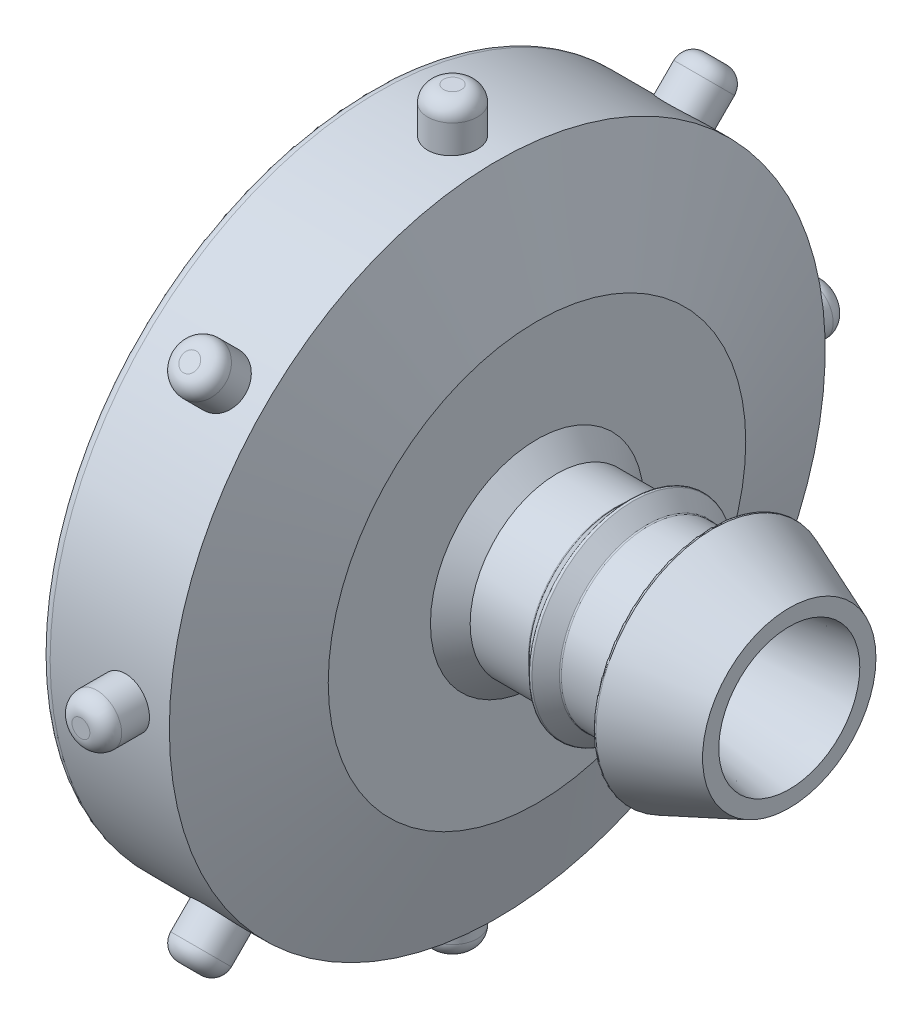
from build123d import *

# Parameters (mm, degrees)
SKETCH2_R                 = 16.51
BOSS_EXTRUDE1_DEPTH       = 1.5
CUT_EXTRUDE1_DEPTH        = 27.579130911
CUT_EXTRUDE1_DEPTH_BACK   = 27.579130911
SKETCH2_5_R               = 2.55
SKETCH2_5_W               = 2.46
SKETCH2_5_H               = 4.35
SKETCH2_6_R               = 16.51
SKETCH2_6_W               = 18.8
SKETCH2_6_H               = 13.4
BOSS_EXTRUDE4_DEPTH       = 8.5
CUT_SWEEP1_PROFILE_R      = 0.9
CHAMFER1_SIZE             = 6
CHAMFER1_SIZE2            = 2
SKETCH18_W                = 3.5
SKETCH18_H                = 7.65
BOSS_EXTRUDE7_DEPTH       = 0.64
FILLET7_R                 = 0.5
CHAMFER5_SIZE             = 1
CHAMFER5_SIZE2            = 4
FILLET9_R                 = 0.5
FILLET10_R                = 0.1
BOSS_EXTRUDE8_START       = -2
BOSS_EXTRUDE8_DEPTH       = 4.2
FILLET11_R                = 0.8
CIRPATTERN4_COUNT         = 8
FILLET11_OF_CIRPATTERN4_R = 0.8
CHAMFER7_SIZE             = 1
CHAMFER8_SIZE             = 7
CHAMFER8_SIZE2            = 1


with BuildPart() as part:
    # Sketch1 → Revolve1 (revolve)
    with BuildSketch(Plane(origin=(0, 0, 0), x_dir=(1, 0, 0), z_dir=(0, 1, 0))):
        Polygon((0, 0), (-12.7, 0), (-12.7, 4.365), (-8.73, 4.365), (-7.94, 5.155), (-7.15, 4.365), (-3.97, 4.365), (-3.97, 5.955), (0, 4.365), align=None)
    revolve(axis=Axis((0, 0, 0), (-1, 0, 0)))

    # Sketch2 → Boss-Extrude1 (add)
    with BuildSketch(Plane.ZY.offset(12.7)):
        Circle(SKETCH2_R)
    extrude(amount=BOSS_EXTRUDE1_DEPTH)

    # Sketch2<5> → Cut-Extrude1 (cut, two sides: drawn at the far end of the back side and taken through both)
    # profile 1 of 2: a face of its own
    with BuildSketch(Plane.ZY.offset(12.7).offset(-CUT_EXTRUDE1_DEPTH_BACK)):
        Circle(SKETCH2_5_R)
        Rectangle(SKETCH2_5_W, SKETCH2_5_H, mode=Mode.SUBTRACT)
    # profile 2 of 2: a face of its own
    with BuildSketch(Plane.ZY.offset(12.7).offset(-CUT_EXTRUDE1_DEPTH_BACK)):
        Rectangle(SKETCH2_5_W, SKETCH2_5_H)
    extrude(amount=CUT_EXTRUDE1_DEPTH + CUT_EXTRUDE1_DEPTH_BACK, mode=Mode.SUBTRACT)

    # Sketch2<6> → Boss-Extrude4 (add)
    with BuildSketch(Plane.ZY.offset(12.7)):
        Circle(SKETCH2_6_R)
        with Locations((0, 0.4)):
            Rectangle(SKETCH2_6_W, SKETCH2_6_H, mode=Mode.SUBTRACT)
    extrude(amount=BOSS_EXTRUDE4_DEPTH)

    # Cut-Sweep1: sweep along a path in Sketch8
    with BuildLine(Plane.ZY.offset(21.2)) as cut_sweep1_path:
        CenterArc((0, 0), 14.14145, 0, 360)
    # Cut-Sweep1 profile (on start of the path) → Cut-Sweep1 (sweep, cut)
    with BuildSketch(Plane(origin=(-21.2, 0, 14.14145), x_dir=(0, 0, 1), z_dir=(0, 1, 0))):
        Circle(CUT_SWEEP1_PROFILE_R)
    sweep(path=cut_sweep1_path.line, mode=Mode.SUBTRACT)

    # Chamfer1
    chamfer1_edges = [part.edges().sort_by_distance(p)[0] for p in [
        (-12.7, 0, -16.51),
    ]]
    chamfer1_side = [part.faces().sort_by_distance(p)[0] for p in [
        (-12.7, 0, -16.043026682),
    ]]
    chamfer(chamfer1_edges, length=CHAMFER1_SIZE, length2=CHAMFER1_SIZE2, reference=chamfer1_side[0])

    # Sketch18 → Boss-Extrude7 (add)
    with BuildSketch(Plane.ZY.offset(14.2)):
        with Locations((-7.65, -2.475)):
            Rectangle(SKETCH18_W, SKETCH18_H)
    extrude(amount=BOSS_EXTRUDE7_DEPTH)

    # Fillet7
    fillet7_edges = [part.edges().sort_by_distance(p)[0] for p in [
        (-14.84, -2.475, -5.9),
        (-14.84, 1.35, -7.65),
    ]]
    fillet(fillet7_edges, radius=FILLET7_R)

    # Fillet8: read off the stored shape, not the designer's step
    # Fillet8 outline → Fillet8 (revolve, cut)
    with BuildSketch(Plane.YX):
        with BuildLine():
            Line((14.906710262, -21.2), (15.756999442, -21.2))
            ThreePointArc((15.756999442, -21.2), (15.270335179, -21.073589088), (14.906710262, -20.726315789))
            Line((14.906710262, -20.726315789), (14.906710262, -21.2))
        make_face()
    revolve(axis=Axis((0, 0, 0), (1, 0, 0)), mode=Mode.SUBTRACT)

    # Chamfer5
    chamfer5_edges = [part.edges().sort_by_distance(p)[0] for p in [
        (-21.2, -6.3, 0),
    ]]
    chamfer5_side = [part.faces().sort_by_distance(p)[0] for p in [
        (-21.2, 0, -12.866925236),
    ]]
    chamfer(chamfer5_edges, length=CHAMFER5_SIZE, length2=CHAMFER5_SIZE2, reference=chamfer5_side[0])

    # Fillet9
    fillet9_edges = [part.edges().sort_by_distance(p)[0] for p in [
        (-21.2, 0, -16.51),
    ]]
    fillet(fillet9_edges, radius=FILLET9_R)

    # Fillet10
    fillet10_edges = [part.edges().sort_by_distance(p)[0] for p in [
        (-3.97, 0, 4.365),
        (-3.97, 0, 5.955),
        (-8.73, 0, 4.365),
        (-7.94, 0, 5.155),
        (-7.15, 0, 4.365),
    ]]
    fillet(fillet10_edges, radius=FILLET10_R)

    # Sketch42 → Boss-Extrude8 (add)
    with BuildSketch(Plane(origin=(0, -16.51, 0), x_dir=(-1, 0, 0), z_dir=(0, -1, 0)).offset(BOSS_EXTRUDE8_START)):
        with BuildLine():
            ThreePointArc((15.7, 0), (16.95, -1.25), (18.2, 0))
            Line((18.2, 0), (15.7, 0))
        make_face()
        with BuildLine():
            Line((15.7, 0), (18.2, 0))
            ThreePointArc((18.2, 0), (16.95, 1.25), (15.7, 0))
        make_face()
    boss_extrude8 = extrude(amount=BOSS_EXTRUDE8_DEPTH)

    # Fillet11
    fillet11_edges = [part.edges().sort_by_distance(p)[0] for p in [
        (-15.7, -18.71, 0),
    ]]
    fillet(fillet11_edges, radius=FILLET11_R)

    # CirPattern4: Boss-Extrude8 ×8 about axis
    cirpattern4_axis = Axis((0, 0, 0), (1, 0, 0))
    for i in range(1, CIRPATTERN4_COUNT):
        add(boss_extrude8.rotate(cirpattern4_axis, i * 360 / CIRPATTERN4_COUNT))

    # Fillet11 of CirPattern4
    fillet11_of_cirpattern4_edges = [part.edges().sort_by_distance(p)[0] for p in [
        (-15.7, -13.229967876, -13.229967876),
        (-15.7, 0, -18.71),
        (-15.7, 13.229967876, -13.229967876),
        (-15.7, 18.71, 0),
        (-15.7, 13.229967876, 13.229967876),
        (-15.7, 0, 18.71),
        (-15.7, -13.229967876, 13.229967876),
    ]]
    fillet(fillet11_of_cirpattern4_edges, radius=FILLET11_OF_CIRPATTERN4_R)

    # Chamfer7
    chamfer7_edges = [part.edges().sort_by_distance(p)[0] for p in [
        (-12.7, 0, 4.365),
    ]]
    chamfer(chamfer7_edges, length=CHAMFER7_SIZE)

    # Chamfer8
    chamfer8_edges = [part.edges().sort_by_distance(p)[0] for p in [
        (0, 0, -2.55),
    ]]
    chamfer8_side = [part.faces().sort_by_distance(p)[0] for p in [
        (-6.35, 0, -2.55),
    ]]
    chamfer(chamfer8_edges, length=CHAMFER8_SIZE, length2=CHAMFER8_SIZE2, reference=chamfer8_side[0])


solid = part.part
